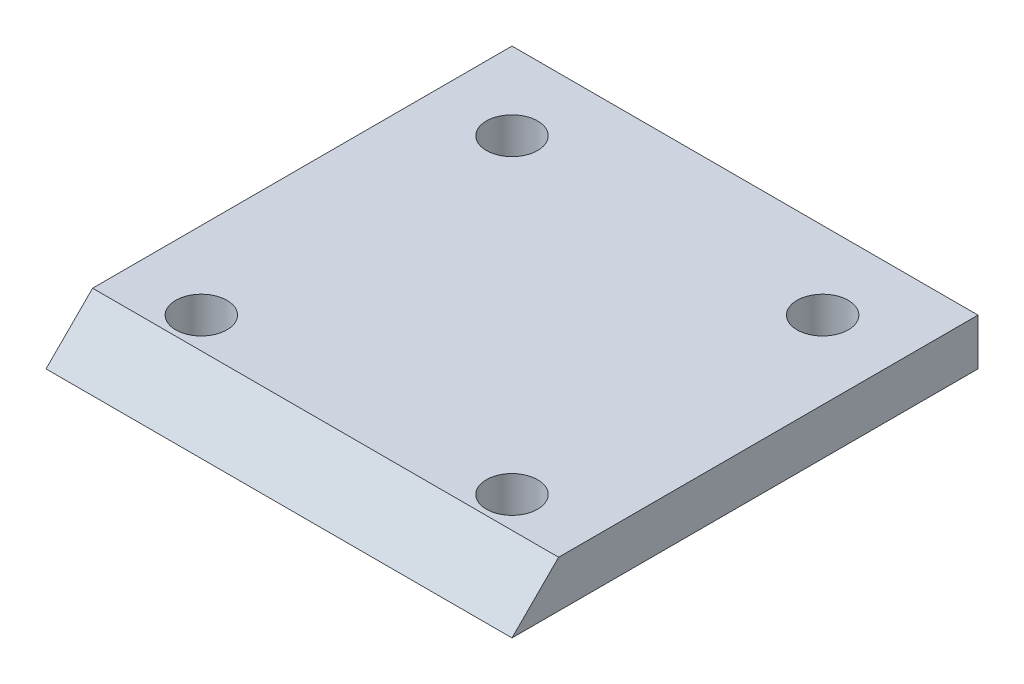
from build123d import *

# Parameters (mm, degrees)
SKETCH1_W             = 30
SKETCH1_H             = 30
BOSS_EXTRUDE1_DEPTH   = 3
M4X0_7_TAPPED_HOLE1_D = 3.3
CHAMFER2_SIZE         = 3


with BuildPart() as part:
    # Sketch1 → Boss-Extrude1 (new body)
    with BuildSketch(Plane(origin=(0, 0, 0), x_dir=(1, 0, 0), z_dir=(0, 1, 0))):
        Rectangle(SKETCH1_W, SKETCH1_H)
    extrude(amount=BOSS_EXTRUDE1_DEPTH)

    # M4x0.7 Tapped Hole1 (through all)
    with Locations(Plane(origin=(0, 3, 0), x_dir=(1, 0, 0), z_dir=(0, 1, 0))):
        with Locations((-10, -10), (-10, 10), (10, 10), (10, -10)):
            Hole(M4X0_7_TAPPED_HOLE1_D / 2)

    # Chamfer2
    chamfer2_edges = [part.edges().sort_by_distance(p)[0] for p in [
        (0, 3, 15),
    ]]
    chamfer(chamfer2_edges, length=CHAMFER2_SIZE - 0.0001)  # a hair under: the kernel refuses the full size


solid = part.part
